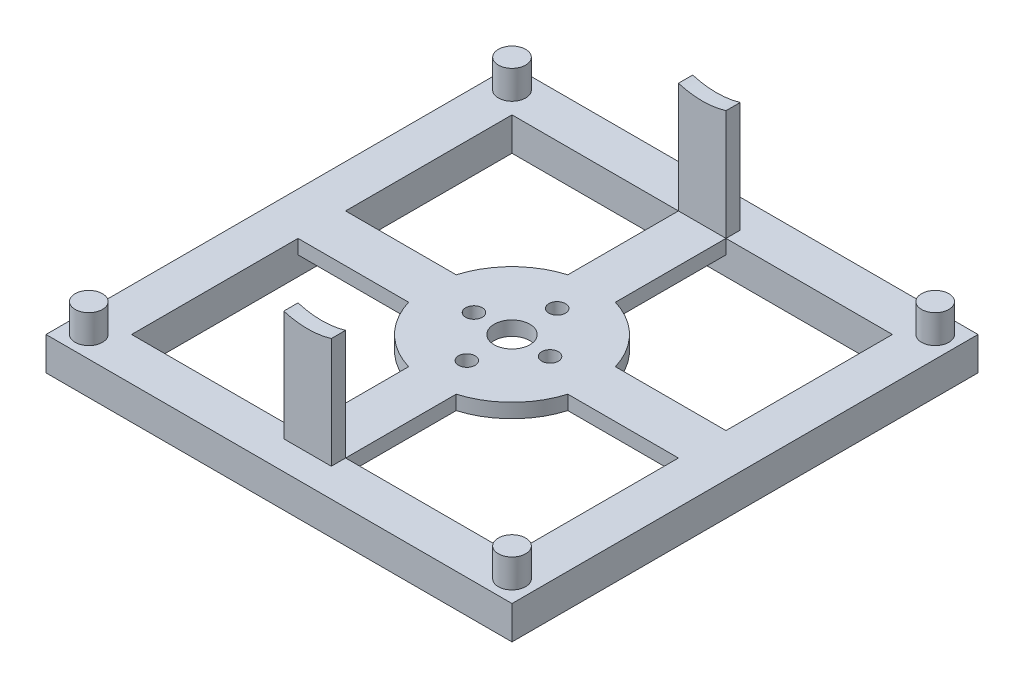
from build123d import *

# Parameters (mm, degrees)
SKETCH2_R                  = 1.75
SKETCH2_W                  = 10
SKETCH2_H                  = 10
BOSS_EXTRUDE1_DEPTH        = 3
CIRPATTERN1_COUNT          = 4
CIRPATTERN2_START          = 40
CIRPATTERN2_OUTLINE_R      = 1.75
CIRPATTERN2_DEPTH          = 3
CIRPATTERN2_START_2        = -43
CIRPATTERN2_2_OUTLINE_R    = 1.75
CIRPATTERN2_2_DEPTH        = 3
CIRPATTERN2_3_OUTLINE_R    = 1.75
CIRPATTERN2_3_DEPTH        = 3
CIRPATTERN2_4_OUTLINE_R    = 1.75
CIRPATTERN2_4_DEPTH        = 3
BOSS_EXTRUDE2_DEPTH        = 50
BOSS_EXTRUDE2_DEPTH_BACK   = 50
SKETCH3_W                  = 10
SKETCH3_H                  = 10
BOSS_EXTRUDE2_2_DEPTH      = 50
BOSS_EXTRUDE2_2_DEPTH_BACK = 50
BOSS_EXTRUDE2_3_DEPTH      = 50
BOSS_EXTRUDE2_3_DEPTH_BACK = 50
BOSS_EXTRUDE2_4_DEPTH      = 50
BOSS_EXTRUDE2_4_DEPTH_BACK = 50
SKETCH4_W                  = 100
SKETCH4_H                  = 100
SKETCH4_W_2                = 80
SKETCH4_H_2                = 80
BOSS_EXTRUDE3_DEPTH        = 10
SKETCH5_W                  = 100
SKETCH5_H                  = 100
SKETCH5_W_2                = 80
SKETCH5_H_2                = 80
BOSS_EXTRUDE4_DEPTH        = 5
CUT_EXTRUDE1_START         = -100
CUT_EXTRUDE1_DEPTH         = 100
CUT_EXTRUDE1_START_2       = -55
CUT_EXTRUDE1_2_OUTLINE_W   = 10
CUT_EXTRUDE1_2_OUTLINE_H   = 3
CUT_EXTRUDE1_2_DEPTH       = 10
CUT_EXTRUDE1_3_OUTLINE_W   = 90
CUT_EXTRUDE1_3_OUTLINE_H   = 3
CUT_EXTRUDE1_3_DEPTH       = 100
SKETCH7_R                  = 3.75
CUT_EXTRUDE2_DEPTH         = 10
SKETCH8_R                  = 3.75
CUT_EXTRUDE3_DEPTH         = 117.828934772
SKETCH9_R                  = 3.75
CUT_EXTRUDE4_DEPTH         = 117.828934772
SKETCH10_W                 = 100
SKETCH10_H                 = 100
CUT_EXTRUDE5_DEPTH         = 3
CUT_EXTRUDE6_DEPTH         = 1
SKETCH12_W                 = 99
SKETCH12_H                 = 97
CUT_EXTRUDE7_DEPTH         = 1
CUT_EXTRUDE8_DEPTH         = 1
SKETCH14_W                 = 98
SKETCH14_H                 = 97
CUT_EXTRUDE9_DEPTH         = 1
CUT_EXTRUDE10_DEPTH        = 117.404467268
CUT_EXTRUDE10_DEPTH_BACK   = 117.404467268
SKETCH15_W                 = 9
SKETCH15_H                 = 5
SKETCH16_R                 = 3.125
CUT_EXTRUDE11_DEPTH        = 8
SKETCH18_W                 = 98
SKETCH18_H                 = 98
SKETCH18_W_2               = 33.4851887
SKETCH18_H_2               = 3
CUT_EXTRUDE12_DEPTH        = 85
SKETCH20_R                 = 2.875
BOSS_EXTRUDE5_DEPTH        = 6
SKETCH21_R                 = 1.75
SKETCH21_R_2               = 3.75
CUT_EXTRUDE13_DEPTH        = 115.341593482


with BuildPart() as part:
    # Sketch2 → Boss-Extrude1 (new body)
    # profile 1 of 13: a face of its own
    with BuildSketch(Plane.XY.offset(40)):
        with BuildLine():
            ThreePointArc((5, -16.74259435), (0, -17.47325), (-5, -16.74259435))
            Line((-5, -16.74259435), (-5, -50))
            Line((-5, -50), (5, -50))
            Line((5, -50), (5, -16.74259435))
        make_face()
    # profile 2 of 13: a face of its own
    with BuildSketch(Plane.XY.offset(40)):
        with BuildLine():
            Line((5, -5), (-5, -5))
            Line((-5, -5), (-5, -16.74259435))
            ThreePointArc((-5, -16.74259435), (0, -17.47325), (5, -16.74259435))
            Line((5, -16.74259435), (5, -5))
        make_face()
        with Locations((0, -9.5)):
            Circle(SKETCH2_R, mode=Mode.SUBTRACT)
    # profile 3 of 13: a face of its own
    with BuildSketch(Plane.XY.offset(40)):
        with BuildLine():
            Line((16.74259435, -5), (5, -5))
            Line((5, -5), (5, -16.74259435))
            ThreePointArc((5, -16.74259435), (12.355453564, -12.355453564), (16.74259435, -5))
        make_face()
    # profile 4 of 13: a face of its own
    with BuildSketch(Plane.XY.offset(40)):
        with BuildLine():
            Line((5, 5), (5, -5))
            Line((5, -5), (16.74259435, -5))
            ThreePointArc((16.74259435, -5), (17.289621197, -2.526551883), (17.47325, 0))
            ThreePointArc((17.47325, 0), (17.289621197, 2.526551883), (16.74259435, 5))
            Line((16.74259435, 5), (5, 5))
        make_face()
        with Locations((8, 0)):
            Circle(SKETCH2_R, mode=Mode.SUBTRACT)
    # profile 5 of 13: a face of its own
    with BuildSketch(Plane.XY.offset(40)):
        Rectangle(SKETCH2_W, SKETCH2_H)
    # profile 6 of 13: a face of its own
    with BuildSketch(Plane.XY.offset(40)):
        with BuildLine():
            Line((-5, -5), (-16.74259435, -5))
            ThreePointArc((-16.74259435, -5), (-12.355453564, -12.355453564), (-5, -16.74259435))
            Line((-5, -16.74259435), (-5, -5))
        make_face()
    # profile 7 of 13: a face of its own
    with BuildSketch(Plane.XY.offset(40)):
        with BuildLine():
            ThreePointArc((-16.74259435, 5), (-17.47325, 0), (-16.74259435, -5))
            Line((-16.74259435, -5), (-5, -5))
            Line((-5, -5), (-5, 5))
            Line((-5, 5), (-16.74259435, 5))
        make_face()
        with Locations((-8, 0)):
            Circle(SKETCH2_R, mode=Mode.SUBTRACT)
    # profile 8 of 13: a face of its own
    with BuildSketch(Plane.XY.offset(40)):
        with BuildLine():
            ThreePointArc((-5, 16.74259435), (-12.355453564, 12.355453564), (-16.74259435, 5))
            Line((-16.74259435, 5), (-5, 5))
            Line((-5, 5), (-5, 16.74259435))
        make_face()
    # profile 9 of 13: a face of its own
    with BuildSketch(Plane.XY.offset(40)):
        with BuildLine():
            Line((-5, 16.74259435), (-5, 5))
            Line((-5, 5), (5, 5))
            Line((5, 5), (5, 16.74259435))
            ThreePointArc((5, 16.74259435), (0, 17.47325), (-5, 16.74259435))
        make_face()
        with Locations((0, 9.5)):
            Circle(SKETCH2_R, mode=Mode.SUBTRACT)
    # profile 10 of 13: a face of its own
    with BuildSketch(Plane.XY.offset(40)):
        with BuildLine():
            Line((5, 16.74259435), (5, 5))
            Line((5, 5), (16.74259435, 5))
            ThreePointArc((16.74259435, 5), (12.355453564, 12.355453564), (5, 16.74259435))
        make_face()
    # profile 11 of 13: a face of its own
    with BuildSketch(Plane.XY.offset(40)):
        with BuildLine():
            ThreePointArc((17.47325, 0), (17.289621197, -2.526551883), (16.74259435, -5))
            Line((16.74259435, -5), (50, -5))
            Line((50, -5), (50, 5))
            Line((50, 5), (16.74259435, 5))
            ThreePointArc((16.74259435, 5), (17.289621197, 2.526551883), (17.47325, 0))
        make_face()
    # profile 12 of 13: a face of its own
    with BuildSketch(Plane.XY.offset(40)):
        with BuildLine():
            Line((-50, 5), (-50, -5))
            Line((-50, -5), (-16.74259435, -5))
            ThreePointArc((-16.74259435, -5), (-17.47325, 0), (-16.74259435, 5))
            Line((-16.74259435, 5), (-50, 5))
        make_face()
    # profile 13 of 13: a face of its own
    with BuildSketch(Plane.XY.offset(40)):
        with BuildLine():
            Line((-5, 50), (-5, 16.74259435))
            ThreePointArc((-5, 16.74259435), (0, 17.47325), (5, 16.74259435))
            Line((5, 16.74259435), (5, 50))
            Line((5, 50), (-5, 50))
        make_face()
    extrude(amount=BOSS_EXTRUDE1_DEPTH)


with BuildPart() as cirpattern1_1:
    # CirPattern1: pattern copy
    add(part.part.rotate(Axis((0, 0, 0), (1, 0, 0)), 1 * 360 / CIRPATTERN1_COUNT))


with BuildPart() as cirpattern1_2:
    # CirPattern1: pattern copy
    add(part.part.rotate(Axis((0, 0, 0), (1, 0, 0)), 2 * 360 / CIRPATTERN1_COUNT))


with BuildPart() as cirpattern1_3:
    # CirPattern1: pattern copy
    add(part.part.rotate(Axis((0, 0, 0), (1, 0, 0)), 3 * 360 / CIRPATTERN1_COUNT))

    # Cut-Extrude1 3 outline → Cut-Extrude1 3 (cut)
    with BuildSketch(Plane.ZY.offset(50).offset(CUT_EXTRUDE1_START)):
        with Locations((5, 41.5)):
            Rectangle(CUT_EXTRUDE1_3_OUTLINE_W, CUT_EXTRUDE1_3_OUTLINE_H)
    extrude(amount=CUT_EXTRUDE1_3_DEPTH, mode=Mode.SUBTRACT)


with BuildPart() as body_5:
    # CirPattern2: read off the stored shape, not the designer's step
    # CirPattern2 outline → CirPattern2 (new body)
    with BuildSketch(Plane.XY.offset(CIRPATTERN2_START)):
        with BuildLine():
            ThreePointArc((5, -16.74259435), (12.355453564, -12.355453564), (16.74259435, -5))
            Line((16.74259435, -5), (50, -5))
            Line((50, -5), (50, 5))
            Line((50, 5), (16.74259435, 5))
            ThreePointArc((16.74259435, 5), (12.355453564, 12.355453564), (5, 16.74259435))
            Line((5, 16.74259435), (5, 50))
            Line((5, 50), (-5, 50))
            Line((-5, 50), (-5, 16.74259435))
            ThreePointArc((-5, 16.74259435), (-12.355453564, 12.355453564), (-16.74259435, 5))
            Line((-16.74259435, 5), (-50, 5))
            Line((-50, 5), (-50, -5))
            Line((-50, -5), (-16.74259435, -5))
            ThreePointArc((-16.74259435, -5), (-12.355453564, -12.355453564), (-5, -16.74259435))
            Line((-5, -16.74259435), (-5, -50))
            Line((-5, -50), (5, -50))
            Line((5, -50), (5, -16.74259435))
        make_face()
        with Locations((0, -9.5)):
            Circle(CIRPATTERN2_OUTLINE_R, mode=Mode.SUBTRACT)
        with Locations((-8, 0)):
            Circle(CIRPATTERN2_OUTLINE_R, mode=Mode.SUBTRACT)
        with Locations((8, 0)):
            Circle(CIRPATTERN2_OUTLINE_R, mode=Mode.SUBTRACT)
        with Locations((0, 9.5)):
            Circle(CIRPATTERN2_OUTLINE_R, mode=Mode.SUBTRACT)
    extrude(amount=CIRPATTERN2_DEPTH)


with BuildPart() as body_6:
    # CirPattern2 2 outline → CirPattern2 2 (new body)
    with BuildSketch(Plane.YZ.offset(CIRPATTERN2_START_2)):
        with BuildLine():
            Line((-5, 50), (-5, 16.74259435))
            ThreePointArc((-5, 16.74259435), (-12.355453564, 12.355453564), (-16.74259435, 5))
            Line((-16.74259435, 5), (-50, 5))
            Line((-50, 5), (-50, -5))
            Line((-50, -5), (-16.74259435, -5))
            ThreePointArc((-16.74259435, -5), (-12.355453564, -12.355453564), (-5, -16.74259435))
            Line((-5, -16.74259435), (-5, -50))
            Line((-5, -50), (5, -50))
            Line((5, -50), (5, -16.74259435))
            ThreePointArc((5, -16.74259435), (12.355453564, -12.355453564), (16.74259435, -5))
            Line((16.74259435, -5), (50, -5))
            Line((50, -5), (50, 5))
            Line((50, 5), (16.74259435, 5))
            ThreePointArc((16.74259435, 5), (12.355453564, 12.355453564), (5, 16.74259435))
            Line((5, 16.74259435), (5, 50))
            Line((5, 50), (-5, 50))
        make_face()
        with Locations((0, -8)):
            Circle(CIRPATTERN2_2_OUTLINE_R, mode=Mode.SUBTRACT)
        with Locations((-9.5, 0)):
            Circle(CIRPATTERN2_2_OUTLINE_R, mode=Mode.SUBTRACT)
        with Locations((9.5, 0)):
            Circle(CIRPATTERN2_2_OUTLINE_R, mode=Mode.SUBTRACT)
        with Locations((0, 8)):
            Circle(CIRPATTERN2_2_OUTLINE_R, mode=Mode.SUBTRACT)
    extrude(amount=CIRPATTERN2_2_DEPTH)


with BuildPart() as body_7:
    # CirPattern2 3 outline → CirPattern2 3 (new body)
    with BuildSketch(Plane.YZ.offset(CIRPATTERN2_START)):
        with BuildLine():
            ThreePointArc((-16.74259435, -5), (-12.355453564, -12.355453564), (-5, -16.74259435))
            Line((-5, -16.74259435), (-5, -50))
            Line((-5, -50), (5, -50))
            Line((5, -50), (5, -16.74259435))
            ThreePointArc((5, -16.74259435), (12.355453564, -12.355453564), (16.74259435, -5))
            Line((16.74259435, -5), (50, -5))
            Line((50, -5), (50, 5))
            Line((50, 5), (16.74259435, 5))
            ThreePointArc((16.74259435, 5), (12.355453564, 12.355453564), (5, 16.74259435))
            Line((5, 16.74259435), (5, 50))
            Line((5, 50), (-5, 50))
            Line((-5, 50), (-5, 16.74259435))
            ThreePointArc((-5, 16.74259435), (-12.355453564, 12.355453564), (-16.74259435, 5))
            Line((-16.74259435, 5), (-50, 5))
            Line((-50, 5), (-50, -5))
            Line((-50, -5), (-16.74259435, -5))
        make_face()
        with Locations((0, -8)):
            Circle(CIRPATTERN2_3_OUTLINE_R, mode=Mode.SUBTRACT)
        with Locations((-9.5, 0)):
            Circle(CIRPATTERN2_3_OUTLINE_R, mode=Mode.SUBTRACT)
        with Locations((9.5, 0)):
            Circle(CIRPATTERN2_3_OUTLINE_R, mode=Mode.SUBTRACT)
        with Locations((0, 8)):
            Circle(CIRPATTERN2_3_OUTLINE_R, mode=Mode.SUBTRACT)
    extrude(amount=CIRPATTERN2_3_DEPTH)


with BuildPart() as body_8:
    # CirPattern2 4 outline → CirPattern2 4 (new body)
    with BuildSketch(Plane.XY.offset(CIRPATTERN2_START_2)):
        with BuildLine():
            Line((50, 5), (16.74259435, 5))
            ThreePointArc((16.74259435, 5), (12.355453564, 12.355453564), (5, 16.74259435))
            Line((5, 16.74259435), (5, 50))
            Line((5, 50), (-5, 50))
            Line((-5, 50), (-5, 16.74259435))
            ThreePointArc((-5, 16.74259435), (-12.355453564, 12.355453564), (-16.74259435, 5))
            Line((-16.74259435, 5), (-50, 5))
            Line((-50, 5), (-50, -5))
            Line((-50, -5), (-16.74259435, -5))
            ThreePointArc((-16.74259435, -5), (-12.355453564, -12.355453564), (-5, -16.74259435))
            Line((-5, -16.74259435), (-5, -50))
            Line((-5, -50), (5, -50))
            Line((5, -50), (5, -16.74259435))
            ThreePointArc((5, -16.74259435), (12.355453564, -12.355453564), (16.74259435, -5))
            Line((16.74259435, -5), (50, -5))
            Line((50, -5), (50, 5))
        make_face()
        with Locations((0, -9.5)):
            Circle(CIRPATTERN2_4_OUTLINE_R, mode=Mode.SUBTRACT)
        with Locations((-8, 0)):
            Circle(CIRPATTERN2_4_OUTLINE_R, mode=Mode.SUBTRACT)
        with Locations((8, 0)):
            Circle(CIRPATTERN2_4_OUTLINE_R, mode=Mode.SUBTRACT)
        with Locations((0, 9.5)):
            Circle(CIRPATTERN2_4_OUTLINE_R, mode=Mode.SUBTRACT)
    extrude(amount=CIRPATTERN2_4_DEPTH)


with BuildPart() as body_9:
    # Sketch3 → Boss-Extrude2 (new, two sides: drawn at the far end of the back side and taken through both)
    with BuildSketch(Plane(origin=(0, 0, 0), x_dir=(1, 0, 0), z_dir=(0, 1, 0)).offset(-BOSS_EXTRUDE2_DEPTH_BACK)):
        with Locations((-45, -45)):
            Rectangle(SKETCH3_W, SKETCH3_H)
    extrude(amount=BOSS_EXTRUDE2_DEPTH + BOSS_EXTRUDE2_DEPTH_BACK)


with BuildPart() as body_10:
    # Sketch3 → Boss-Extrude2 2 (new, two sides: drawn at the far end of the back side and taken through both)
    with BuildSketch(Plane(origin=(0, 0, 0), x_dir=(1, 0, 0), z_dir=(0, 1, 0)).offset(-BOSS_EXTRUDE2_2_DEPTH_BACK)):
        with Locations((45, -45)):
            Rectangle(SKETCH3_W, SKETCH3_H)
    extrude(amount=BOSS_EXTRUDE2_2_DEPTH + BOSS_EXTRUDE2_2_DEPTH_BACK)


with BuildPart() as body_11:
    # Sketch3 → Boss-Extrude2 3 (new, two sides: drawn at the far end of the back side and taken through both)
    with BuildSketch(Plane(origin=(0, 0, 0), x_dir=(1, 0, 0), z_dir=(0, 1, 0)).offset(-BOSS_EXTRUDE2_3_DEPTH_BACK)):
        with Locations((45, 45)):
            Rectangle(SKETCH3_W, SKETCH3_H)
    extrude(amount=BOSS_EXTRUDE2_3_DEPTH + BOSS_EXTRUDE2_3_DEPTH_BACK)


with BuildPart() as body_12:
    # Sketch3 → Boss-Extrude2 4 (new, two sides: drawn at the far end of the back side and taken through both)
    with BuildSketch(Plane(origin=(0, 0, 0), x_dir=(1, 0, 0), z_dir=(0, 1, 0)).offset(-BOSS_EXTRUDE2_4_DEPTH_BACK)):
        with Locations((-45, 45)):
            Rectangle(SKETCH3_W, SKETCH3_H)
    extrude(amount=BOSS_EXTRUDE2_4_DEPTH + BOSS_EXTRUDE2_4_DEPTH_BACK)


with BuildPart() as part_1:
    add(part.part)

    add(cirpattern1_1.part)  # Boss-Extrude3 merges CirPattern1_1

    add(cirpattern1_2.part)  # Boss-Extrude3 merges CirPattern1_2

    add(body_5.part)  # Boss-Extrude3 merges body 5

    add(body_6.part)  # Boss-Extrude3 merges body 6

    add(body_7.part)  # Boss-Extrude3 merges body 7

    add(body_8.part)  # Boss-Extrude3 merges body 8

    add(body_9.part)  # Boss-Extrude3 merges body 9

    add(body_10.part)  # Boss-Extrude3 merges body 10

    add(body_11.part)  # Boss-Extrude3 merges body 11

    add(body_12.part)  # Boss-Extrude3 merges body 12
    # Sketch4 → Boss-Extrude3 (add)
    with BuildSketch(Plane.XZ.offset(50)):
        Rectangle(SKETCH4_W, SKETCH4_H)
        Rectangle(SKETCH4_W_2, SKETCH4_H_2, mode=Mode.SUBTRACT)
    extrude(amount=-BOSS_EXTRUDE3_DEPTH)

    # Sketch5 → Boss-Extrude4 (add)
    with BuildSketch(Plane(origin=(0, 50, 0), x_dir=(1, 0, 0), z_dir=(0, 1, 0))):
        Rectangle(SKETCH5_W, SKETCH5_H)
        Rectangle(SKETCH5_W_2, SKETCH5_H_2, mode=Mode.SUBTRACT)
    extrude(amount=-BOSS_EXTRUDE4_DEPTH)

    # Cut-Extrude1: read off the stored shape, not the designer's step
    # Cut-Extrude1 outline → Cut-Extrude1 (cut)
    with BuildSketch(Plane.ZY.offset(50).offset(CUT_EXTRUDE1_START)):
        with BuildLine():
            Line((40, 50), (-40, 50))
            Line((-40, 50), (-40, 45))
            Line((-40, 45), (-5, 45))
            Line((-5, 45), (-5, 16.74259435))
            ThreePointArc((-5, 16.74259435), (0, 17.47325), (5, 16.74259435))
            Line((5, 16.74259435), (5, 45))
            Line((5, 45), (40, 45))
            Line((40, 45), (40, 50))
        make_face()
    extrude(amount=CUT_EXTRUDE1_DEPTH, mode=Mode.SUBTRACT)

    # Sketch7 → Cut-Extrude2 (cut)
    with BuildSketch(Plane.XZ.offset(43)):
        with Locations(Location((0, 0, 0), (0, 0, 270))):
            Circle(SKETCH7_R)
    extrude(amount=-CUT_EXTRUDE2_DEPTH, mode=Mode.SUBTRACT)

    # Sketch8 → Cut-Extrude3 (cut, through all)
    with BuildSketch(Plane.ZY.offset(43)):
        Circle(SKETCH8_R)
    extrude(amount=-CUT_EXTRUDE3_DEPTH, mode=Mode.SUBTRACT)

    # Sketch9 → Cut-Extrude4 (cut, through all)
    with BuildSketch(Plane(origin=(0, 0, -43), x_dir=(-1, 0, 0), z_dir=(0, 0, -1))):
        Circle(SKETCH9_R)
    extrude(amount=-CUT_EXTRUDE4_DEPTH, mode=Mode.SUBTRACT)

    # Sketch10 → Cut-Extrude5 (cut)
    with BuildSketch(Plane.XZ.offset(50)):
        Rectangle(SKETCH10_W, SKETCH10_H)
    extrude(amount=-CUT_EXTRUDE5_DEPTH, mode=Mode.SUBTRACT)

    # Sketch11 → Cut-Extrude6 (cut)
    with BuildSketch(Plane.ZY.offset(50)):
        Polygon((50, 50), (40, 50), (40, -40), (-40, -40), (-40, 50), (-50, 50), (-50, -47), (50, -47), align=None)
    extrude(amount=-CUT_EXTRUDE6_DEPTH, mode=Mode.SUBTRACT)

    # Sketch12 → Cut-Extrude7 (cut)
    with BuildSketch(Plane.XY.offset(50)):
        with Locations((0.5, 1.5)):
            Rectangle(SKETCH12_W, SKETCH12_H)
    extrude(amount=-CUT_EXTRUDE7_DEPTH, mode=Mode.SUBTRACT)

    # Sketch13 → Cut-Extrude8 (cut)
    with BuildSketch(Plane(origin=(50, 0, 0), x_dir=(0, 0, -1), z_dir=(1, 0, 0))):
        Polygon((50, 50), (40, 50), (40, -40), (-40, -40), (-40, 50), (-49, 50), (-49, -47), (50, -47), align=None)
    extrude(amount=-CUT_EXTRUDE8_DEPTH, mode=Mode.SUBTRACT)

    # Sketch14 → Cut-Extrude9 (cut)
    with BuildSketch(Plane(origin=(0, 0, -50), x_dir=(-1, 0, 0), z_dir=(0, 0, -1))):
        with Locations((0, 1.5)):
            Rectangle(SKETCH14_W, SKETCH14_H)
    extrude(amount=-CUT_EXTRUDE9_DEPTH, mode=Mode.SUBTRACT)


with BuildPart() as body_3:
    # Cut-Extrude1 2 outline → Cut-Extrude1 2 (new body)
    with BuildSketch(Plane.ZY.offset(50).offset(CUT_EXTRUDE1_START_2)):
        with Locations((45, 41.5)):
            Rectangle(CUT_EXTRUDE1_2_OUTLINE_W, CUT_EXTRUDE1_2_OUTLINE_H)
    extrude(amount=CUT_EXTRUDE1_2_DEPTH)


with BuildPart() as cut_extrude10_tool:
    # Sketch15 → Cut-Extrude10 (new, two sides: drawn at the far end of the back side and taken through both)
    with BuildSketch(Plane.XY.offset(43).offset(-CUT_EXTRUDE10_DEPTH_BACK)):
        with Locations((-44.5, 47.5)):
            Rectangle(SKETCH15_W, SKETCH15_H)
        Polygon((-40, 50), (-40, 45), (-5, 45), (5, 45), (40, 45), (40, 50), align=None)
        with Locations((44.5, 47.5)):
            Rectangle(SKETCH15_W, SKETCH15_H)
        with BuildLine():
            Line((5, 45), (-5, 45))
            Line((-5, 45), (-5, 16.74259435))
            ThreePointArc((-5, 16.74259435), (0, 17.47325), (5, 16.74259435))
            Line((5, 16.74259435), (5, 45))
        make_face()
    extrude(amount=CUT_EXTRUDE10_DEPTH + CUT_EXTRUDE10_DEPTH_BACK)


with BuildPart() as part_2:
    add(part_1.part)

    # Cut-Extrude10: cut by cut_extrude10_tool
    add(cut_extrude10_tool.part, mode=Mode.SUBTRACT)

    # Sketch16 → Cut-Extrude11 (cut)
    with BuildSketch(Plane(origin=(0, 45, 0), x_dir=(1, 0, 0), z_dir=(0, 1, 0))):
        with Locations(Location((-44.5, -44.5, 0), (0, 0, 270))):
            Circle(SKETCH16_R)
        with Locations(Location((44.5, -44.5, 0), (0, 0, 90))):
            Circle(SKETCH16_R)
        with Locations(Location((44.5, 44.5, 0), (0, 0, 270))):
            Circle(SKETCH16_R)
        with Locations(Location((-44.5, 44.5, 0), (0, 0, 90))):
            Circle(SKETCH16_R)
    extrude(amount=-CUT_EXTRUDE11_DEPTH, mode=Mode.SUBTRACT)

    # Sketch18 → Cut-Extrude12 (cut)
    with BuildSketch(Plane(origin=(0, 45, 0), x_dir=(1, 0, 0), z_dir=(0, 1, 0))):
        Rectangle(SKETCH18_W, SKETCH18_H)
        with Locations((0, 41.5)):
            Rectangle(SKETCH18_W_2, SKETCH18_H_2, mode=Mode.SUBTRACT)
        with Locations((0, -41.5)):
            Rectangle(SKETCH18_W_2, SKETCH18_H_2, mode=Mode.SUBTRACT)
    extrude(amount=-CUT_EXTRUDE12_DEPTH, mode=Mode.SUBTRACT)

    # Sketch20 → Boss-Extrude5 (add)
    with BuildSketch(Plane(origin=(0, -40, 0), x_dir=(1, 0, 0), z_dir=(0, 1, 0))):
        with Locations(Location((44.5, 44.5, 0), (0, 0, 90))):
            Circle(SKETCH20_R)
        with Locations(Location((44.5, -44.5, 0), (0, 0, 90))):
            Circle(SKETCH20_R)
        with Locations(Location((-44.5, -44.5, 0), (0, 0, 90))):
            Circle(SKETCH20_R)
        with Locations(Location((-44.5, 44.5, 0), (0, 0, 90))):
            Circle(SKETCH20_R)
    extrude(amount=BOSS_EXTRUDE5_DEPTH)

    # Sketch21 → Cut-Extrude13 (cut, through all)
    with BuildSketch(Plane(origin=(0, 0, -43), x_dir=(-1, 0, 0), z_dir=(0, 0, -1))):
        with BuildLine():
            ThreePointArc((5, -16.74259435), (12.355453564, -12.355453564), (16.74259435, -5))
            Line((16.74259435, -5), (16.74259435, 5))
            ThreePointArc((16.74259435, 5), (0, 17.47325), (-16.74259435, 5))
            Line((-16.74259435, 5), (-16.74259435, -5))
            ThreePointArc((-16.74259435, -5), (-12.355453564, -12.355453564), (-5, -16.74259435))
            ThreePointArc((-5, -16.74259435), (0, -17.47325), (5, -16.74259435))
        make_face()
        with Locations((-8, 0)):
            Circle(SKETCH21_R, mode=Mode.SUBTRACT)
        with Locations((0, -9.5)):
            Circle(SKETCH21_R, mode=Mode.SUBTRACT)
        Circle(SKETCH21_R_2, mode=Mode.SUBTRACT)
        with Locations((8, 0)):
            Circle(SKETCH21_R, mode=Mode.SUBTRACT)
        with Locations((0, 9.5)):
            Circle(SKETCH21_R, mode=Mode.SUBTRACT)
    extrude(amount=-CUT_EXTRUDE13_DEPTH, mode=Mode.SUBTRACT)


with BuildPart() as cirpattern1_3_1:
    add(cirpattern1_3.part)

    # Cut-Extrude10: cut by cut_extrude10_tool
    add(cut_extrude10_tool.part, mode=Mode.SUBTRACT)


with BuildPart() as body_3_1:
    add(body_3.part)

    # Cut-Extrude10: cut by cut_extrude10_tool
    add(cut_extrude10_tool.part, mode=Mode.SUBTRACT)


solid = part_2.part
